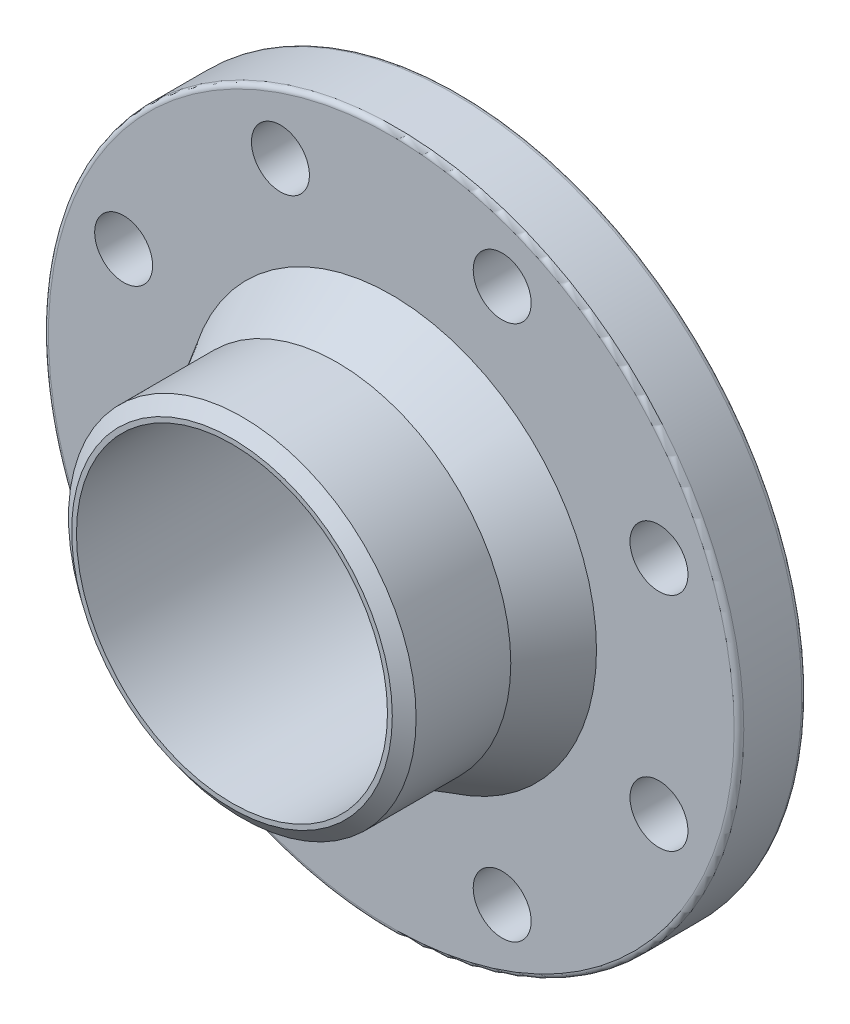
from build123d import *

# Parameters (mm, degrees)
SKETCH1_R                 = 114.3
BOSS_EXTRUDE1_DEPTH       = 23.8125
SKETCH2_R                 = 9.525
BOLTHOLE_DEPTH            = 164.389152505
BOLTHOLEPATTERN_COUNT     = 8
SKETCH5_OUTSIDE_W         = 295.434
SKETCH5_OUTSIDE_H         = 295.434
SKETCH5_OUTSIDE_R         = 78.58125
RAISED_FACE_DEPTH         = 1.5875
SKETCH8_R                 = 67.4624
WELD_NECK_120_DRAFT_DEPTH = 52.3875
WELD_NECK_120_DRAFT_TAPER = 30
WELD_NECK_END_REACH       = 180.705
SKETCH9_R                 = 57.15
WELD_NECK_CHAMFER1_SIZE   = 3.401023409
WELD_NECK_CHAMFER1_SIZE2  = 4.4323
SKETCH7_R                 = 51.1302
BORE_DEPTH                = 179.704840449
FILLET2_R                 = 1.5875
FILLET3_R                 = 1.5875


with BuildPart() as part:
    # Sketch1 → Boss-Extrude1 (new body)
    with BuildSketch(Plane.XY):
        Circle(SKETCH1_R)
    extrude(amount=BOSS_EXTRUDE1_DEPTH)

    # Sketch2 → BoltHole (cut, through all)
    with BuildSketch(Plane.XY):
        with Locations((36.450596933, 87.999525472)):
            Circle(SKETCH2_R)
    bolthole = extrude(amount=BOLTHOLE_DEPTH, mode=Mode.SUBTRACT)

    # BoltHolePattern: BoltHole ×8 about axis
    boltholepattern_axis = Axis((0, 0, 0), (0, 0, 1))
    for i in range(1, BOLTHOLEPATTERN_COUNT):
        add(bolthole.rotate(boltholepattern_axis, i * 360 / BOLTHOLEPATTERN_COUNT), mode=Mode.SUBTRACT)

    # Sketch5 outside → Raised Face (cut)
    with BuildSketch(Plane(origin=(0, 0, 0), x_dir=(-1, 0, 0), z_dir=(0, 0, -1))):
        Rectangle(SKETCH5_OUTSIDE_W, SKETCH5_OUTSIDE_H)
        Circle(SKETCH5_OUTSIDE_R, mode=Mode.SUBTRACT)
    extrude(amount=-RAISED_FACE_DEPTH, mode=Mode.SUBTRACT)

    # Sketch8 → Weld Neck 120 Draft (add)
    with BuildSketch(Plane.XY.offset(23.8125)):
        Circle(SKETCH8_R)
    extrude(amount=WELD_NECK_120_DRAFT_DEPTH, taper=WELD_NECK_120_DRAFT_TAPER)

    # Sketch9 → Weld Neck End (add, up to next)
    with BuildSketch(Plane.XY.offset(76.2), mode=Mode.PRIVATE) as weld_neck_end_sk1:
        Circle(SKETCH9_R)
    weld_neck_end_tool1 = extrude(weld_neck_end_sk1.sketch, amount=-WELD_NECK_END_REACH, mode=Mode.PRIVATE) - part.part
    add(weld_neck_end_tool1.solids().sort_by_distance((0, 0, 76.2))[0])

    # Weld Neck Chamfer1
    weld_neck_chamfer1_edges = [part.edges().sort_by_distance(p)[0] for p in [
        (-57.15, 0, 76.2),
    ]]
    weld_neck_chamfer1_side = [part.faces().sort_by_distance(p)[0] for p in [
        (-57.15, 0, 58.937050374),
    ]]
    chamfer(weld_neck_chamfer1_edges, length=WELD_NECK_CHAMFER1_SIZE, length2=WELD_NECK_CHAMFER1_SIZE2, reference=weld_neck_chamfer1_side[0])

    # Sketch7 → Bore (cut, through all)
    with BuildSketch(Plane.XY):
        with Locations(Location((0, 0, 0), (0, 0, 180))):
            Circle(SKETCH7_R)
    extrude(amount=BORE_DEPTH, mode=Mode.SUBTRACT)

    # Fillet2
    fillet2_edges = [part.edges().sort_by_distance(p)[0] for p in [
        (-114.3, 0, 23.8125),
        (-114.3, 0, 1.5875),
    ]]
    fillet(fillet2_edges, radius=FILLET2_R)

    # Fillet3
    fillet3_edges = [part.edges().sort_by_distance(p)[0] for p in [
        (78.58125, 0, 1.5875),
    ]]
    fillet(fillet3_edges, radius=FILLET3_R - 0.0001)  # a hair under: the kernel refuses the full size


solid = part.part
